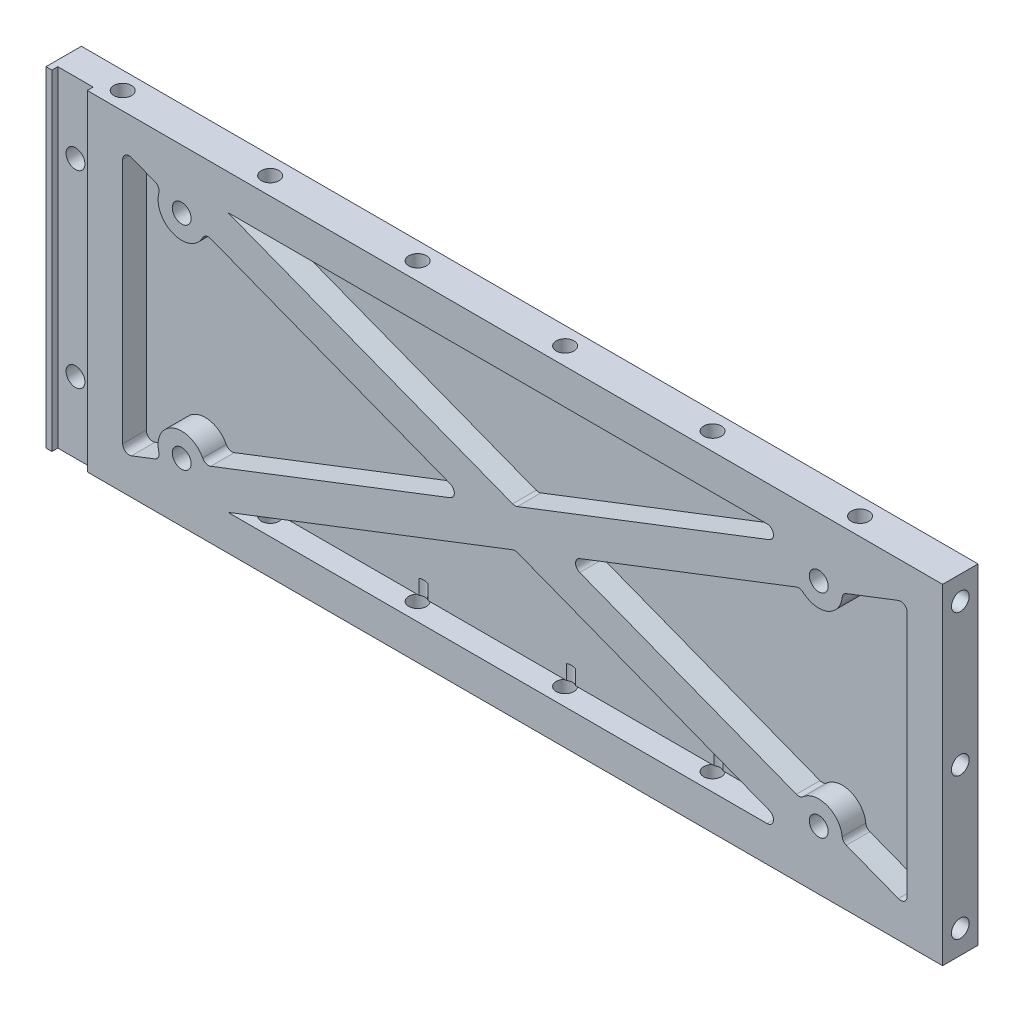
from build123d import *

# Parameters (mm, degrees)
SKETCH_2_W                   = 152
SKETCH_2_H                   = 56
EXTRUDE_1_DEPTH              = 3
CUT_EXTRUDE_START            = 3
SKETCH_2_3_W                 = 6
SKETCH_2_3_H                 = 56
CUT_EXTRUDE_1_DEPTH          = 1
HOLE_WIZARD_M3_1_D           = 3.2
HOLE_WIZARD_M3_1_CSINK_D     = 6.3
HOLE_WIZARD_M3_1_CSINK_ANGLE = 90
PATTERN_LINEAR_2_COUNT       = 6
PATTERN_LINEAR_2_PITCH       = 25
M3X0_5_1_D                   = 2.5
M3X0_5_1_DEPTH               = 10.5
M3X0_5_1_CBORE_D             = 3
M3X0_5_1_CBORE_DEPTH         = 8
M3X0_5_1_TIP                 = 0.751075774
M3X0_5_2_D                   = 2.5
M3X0_5_2_DEPTH               = 10.5
M3X0_5_2_CBORE_D             = 3
M3X0_5_2_CBORE_DEPTH         = 8
M3X0_5_2_TIP                 = 0.751075774
M3X0_5_4_D                   = 2.5
M3X0_5_4_DEPTH               = 8.5
M3X0_5_4_CBORE_D             = 3
M3X0_5_4_CBORE_DEPTH         = 6
M3X0_5_4_TIP                 = 0.751075774
CUT_EXTRUDE_2_DEPTH          = 4
FILLET_3_R                   = 1.1


# Read off the part's stored shape, not the designer's step: M3x0.5 ねじ穴3
with BuildPart() as part:
    # ｽｹｯﾁ2 → ﾎﾞｽ - 押し出し1 (new, symmetric)
    with BuildSketch(Plane.XY):
        Rectangle(SKETCH_2_W, SKETCH_2_H)
    extrude(amount=EXTRUDE_1_DEPTH, both=True)

    # ｽｹｯﾁ2<3> → ｶｯﾄ - 押し出し1 (cut)
    with BuildSketch(Plane.XY.offset(CUT_EXTRUDE_START)):
        with Locations((-72, 0)):
            Rectangle(SKETCH_2_3_W, SKETCH_2_3_H)
    extrude(amount=-CUT_EXTRUDE_1_DEPTH, mode=Mode.SUBTRACT)

    # M3 丸皿ねじ用皿穴1 (through all)
    with Locations(Plane(origin=(55, 18, -3), x_dir=(-1, 0, 0), z_dir=(0, 0, -1))):
        with Locations((0, 0), (108, 0), (127, -2), (127, -34), (108, -36), (0, -36)):
            CounterSinkHole(HOLE_WIZARD_M3_1_D / 2, HOLE_WIZARD_M3_1_CSINK_D / 2, counter_sink_angle=HOLE_WIZARD_M3_1_CSINK_ANGLE)

    # M3x0.5 ねじ穴3 outline → M3x0.5 ねじ穴3 (revolve, cut)
    with BuildSketch(Plane(origin=(-66, 0, 0), x_dir=(1, 0, 0), z_dir=(0, 0, 1))):
        Polygon((0, 28), (0, 18.748924226), (1.25, 19.5), (1.25, 22), (1.5, 22), (1.5, 28), align=None)
        Polygon((1.25, -19.5), (0, -18.748924226), (0, -28), (1.5, -28), (1.5, -22), (1.25, -22), align=None)
    m3x0_5_3 = revolve(axis=Axis((-66, 0, 0), (0, 1, 0)), mode=Mode.SUBTRACT)

    # 直線ﾊﾟﾀｰﾝ2: M3x0.5 ねじ穴3 ×6
    with Locations(*[(i * PATTERN_LINEAR_2_PITCH, 0, 0) for i in range(1, PATTERN_LINEAR_2_COUNT)]):
        add(m3x0_5_3, mode=Mode.SUBTRACT)

    # M3x0.5 ねじ穴1
    with Locations(Plane(origin=(-76, 12, 0), x_dir=(0, -1, 0), z_dir=(-1, 0, 0))):
        with Locations((0, 0)):
            CounterBoreHole(M3X0_5_1_D / 2, M3X0_5_1_CBORE_D / 2, M3X0_5_1_CBORE_DEPTH, depth=M3X0_5_1_DEPTH)
            with Locations((0, 0, -(M3X0_5_1_DEPTH + M3X0_5_1_TIP / 2))):  # 118° drill point
                Cone(0, M3X0_5_1_D / 2, M3X0_5_1_TIP, mode=Mode.SUBTRACT)

    # M3x0.5 ねじ穴2
    with Locations(Plane(origin=(-76, -12, 0), x_dir=(0, -1, 0), z_dir=(-1, 0, 0))):
        with Locations((0, 0)):
            CounterBoreHole(M3X0_5_2_D / 2, M3X0_5_2_CBORE_D / 2, M3X0_5_2_CBORE_DEPTH, depth=M3X0_5_2_DEPTH)
            with Locations((0, 0, -(M3X0_5_2_DEPTH + M3X0_5_2_TIP / 2))):  # 118° drill point
                Cone(0, M3X0_5_2_D / 2, M3X0_5_2_TIP, mode=Mode.SUBTRACT)

    # M3x0.5 ねじ穴4
    with Locations(Plane(origin=(76, 24, 0), x_dir=(0, 0, 1), z_dir=(1, 0, 0))):
        with Locations((0, 0), (0, 24), (0, 48)):
            CounterBoreHole(M3X0_5_4_D / 2, M3X0_5_4_CBORE_D / 2, M3X0_5_4_CBORE_DEPTH, depth=M3X0_5_4_DEPTH)
            with Locations((0, 0, -(M3X0_5_4_DEPTH + M3X0_5_4_TIP / 2))):  # 118° drill point
                Cone(0, M3X0_5_4_D / 2, M3X0_5_4_TIP, mode=Mode.SUBTRACT)

    # ｽｹｯﾁ8 → ｶｯﾄ - 押し出し2 (cut)
    with BuildSketch(Plane.XY.offset(3)):
        with BuildLine():
            Line((58.994149523, -18.21626277), (70, -22.466798126))
            Line((70, -22.466798126), (70, 22.466798126))
            Line((70, 22.466798126), (58.994149523, 18.21626277))
            ThreePointArc((58.994149523, 18.21626277), (56.441088212, 14.26861088), (51.897336691, 15.47542471))
            Line((51.897336691, 15.47542471), (11.827040566, 0))
            Line((11.827040566, 0), (51.897336691, -15.47542471))
            ThreePointArc((51.897336691, -15.47542471), (56.441088212, -14.26861088), (58.994149523, -18.21626277))
        make_face()
        with BuildLine():
            Line((-63, 22.466798126), (-56.490858443, 19.952922766))
            ThreePointArc((-56.490858443, 19.952922766), (-54.441088212, 14.26861088), (-49.10266825, 17.099552761))
            Line((-49.10266825, 17.099552761), (-4.827040566, 0))
            Line((-4.827040566, 0), (-49.10266825, -17.099552761))
            ThreePointArc((-49.10266825, -17.099552761), (-54.441088212, -14.26861088), (-56.490858443, -19.952922766))
            Line((-56.490858443, -19.952922766), (-63, -22.466798126))
            Line((-63, -22.466798126), (-63, 22.466798126))
        make_face()
        Polygon((-45.137245148, -22), (3.5, -3.215960495), (52.137245148, -22), align=None)
        Polygon((-45.137245148, 22), (3.5, 3.215960495), (52.137245148, 22), align=None)
    extrude(amount=-CUT_EXTRUDE_2_DEPTH, mode=Mode.SUBTRACT)

    # ﾌｨﾚｯﾄ3
    fillet_3_edges = [part.edges().sort_by_distance(p)[0] for p in [
        (3.5, 3.215960495, 1),
        (52.137245148, 22, 1),
        (70, 22.466798126, 1),
        (51.897336691, 15.47542471, 1),
        (58.994149523, 18.21626277, 1),
        (70, -22.466798126, 1),
        (58.994149523, -18.21626277, 1),
        (51.897336691, -15.47542471, 1),
        (11.827040566, 0, 1),
        (52.137245148, -22, 1),
        (3.5, -3.215960495, 1),
        (-56.490858443, 19.952922766, 1),
        (-49.10266825, 17.099552761, 1),
        (-4.827040566, 0, 1),
        (-49.10266825, -17.099552761, 1),
        (-56.490858443, -19.952922766, 1),
        (-63, -22.466798126, 1),
        (-63, 22.466798126, 1),
    ]]
    fillet(fillet_3_edges, radius=FILLET_3_R)


solid = part.part
